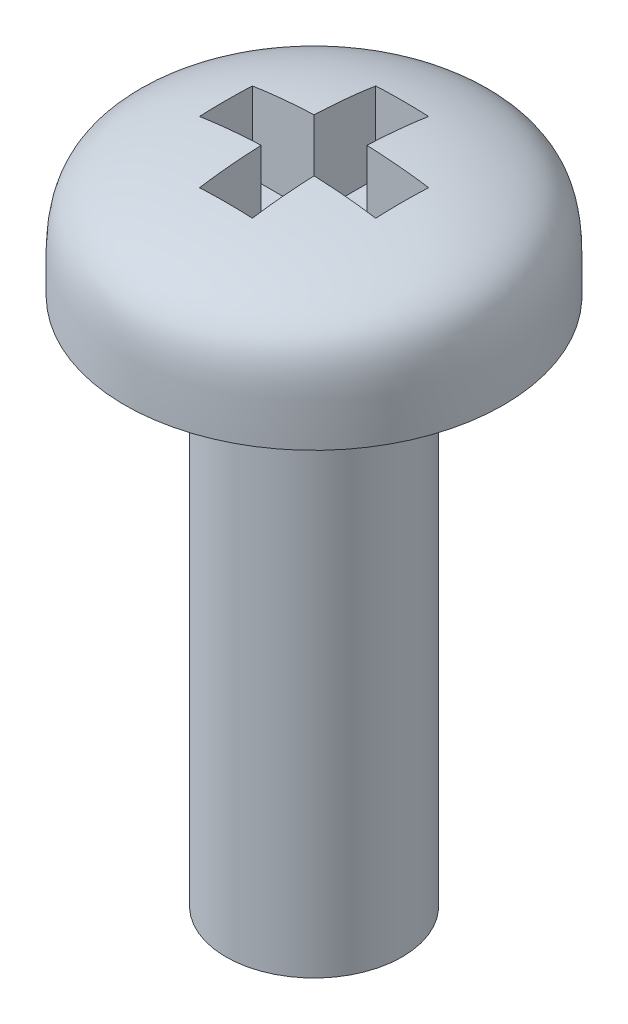
from build123d import *

# Parameters (mm, degrees)
REVOLVE1_OUTLINE_W = 1.27
REVOLVE1_OUTLINE_H = 7.62
SKETCH2_W          = 1.27
SKETCH2_H          = 0.762
CUT_EXTRUDE1_DEPTH = 1.27
CIRPATTERN1_COUNT  = 4


# Read off the part's stored shape, not the designer's step: Revolve1
with BuildPart() as part:
    # Revolve1 outline → Revolve1 (revolve)
    with BuildSketch(Plane.XY):
        with Locations((0.635, 3.81)):
            Rectangle(REVOLVE1_OUTLINE_W, REVOLVE1_OUTLINE_H)
        with BuildLine():
            Line((0, 9.525), (0, 7.62))
            Line((0, 7.62), (1.27, 7.62))
            Line((1.27, 7.62), (1.27, 9.421457579))
            add(Edge.make_bspline(
                [(1.27, 9.421457579), (1.228139819, 9.428026655), (0.811912502, 9.488262021), (0.384414806, 9.507605733), (0, 9.525)],
                knots=[0.678395856, 0.678395856, 0.678395856, 0.678395856, 0.710806875, 1, 1, 1, 1], degree=3))
        make_face()
        with BuildLine():
            Line((1.27, 9.421457579), (1.27, 7.62))
            Line((1.27, 7.62), (2.7305, 7.62))
            add(Edge.make_bspline(
                [(2.7305, 7.62), (2.730181564, 7.703312624), (2.729863127, 7.786625248), (2.7305, 7.873222802)],
                knots=[0, 0, 0, 0, 0.063828226, 0.063828226, 0.063828226, 0.063828226], degree=3))
            Line((2.7305, 7.873222802), (2.7305, 8.214607098))
            add(Edge.make_bspline(
                [(2.7305, 8.214607098), (2.72332571, 8.473946678), (2.657632203, 8.947113323), (1.963979921, 9.279802566), (1.518244272, 9.38250086), (1.27, 9.421457579)],
                knots=[0.145285385, 0.145285385, 0.145285385, 0.145285385, 0.328975575, 0.486188137, 0.678395856, 0.678395856, 0.678395856, 0.678395856], degree=3))
        make_face()
        with BuildLine():
            Line((2.7305, 8.214607098), (2.7305, 7.873222802))
            add(Edge.make_bspline(
                [(2.7305, 7.873222802), (2.731005418, 7.941946006), (2.73211248, 8.012738026), (2.73211248, 8.084105221)],
                knots=[0.063828226, 0.063828226, 0.063828226, 0.063828226, 0.114481853, 0.114481853, 0.114481853, 0.114481853], degree=3))
            add(Edge.make_bspline(
                [(2.73211248, 8.084105221), (2.73211248, 8.127505109), (2.731703077, 8.171117703), (2.7305, 8.214607098)],
                knots=[0.114481853, 0.114481853, 0.114481853, 0.114481853, 0.145285385, 0.145285385, 0.145285385, 0.145285385], degree=3))
        make_face()
    revolve(axis=Axis((0, 0, 0), (0, 1, 0)))

    # Sketch2 → Cut-Extrude1 (cut)
    with BuildSketch(Plane.XZ.offset(-9.525)):
        with Locations((0.635, 0)):
            Rectangle(SKETCH2_W, SKETCH2_H)
    cut_extrude1 = extrude(amount=CUT_EXTRUDE1_DEPTH, mode=Mode.SUBTRACT)

    # CirPattern1: Cut-Extrude1 ×4 about axis
    cirpattern1_axis = Axis((0, 0, 0), (0, 1, 0))
    for i in range(1, CIRPATTERN1_COUNT):
        add(cut_extrude1.rotate(cirpattern1_axis, i * 360 / CIRPATTERN1_COUNT), mode=Mode.SUBTRACT)


solid = part.part
